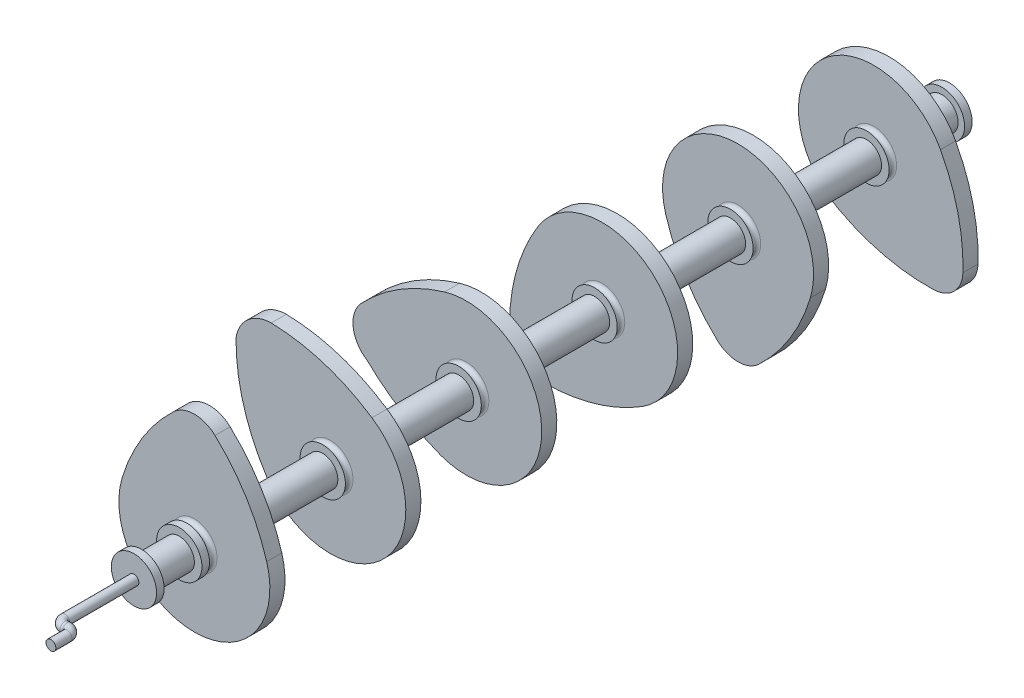
from build123d import *

# Parameters (mm, degrees)
SKETCH1_R            = 76.2
BOSS_EXTRUDE4_DEPTH  = 25.4
SKETCH7_R            = 50.8
BOSS_EXTRUDE5_DEPTH  = 127
SKETCH8_R            = 76.2
BOSS_EXTRUDE6_DEPTH  = 25.4
BOSS_EXTRUDE7_DEPTH  = 50.8
BOSS_EXTRUDE8_START  = 381
SKETCH12_R           = 50.8
BOSS_EXTRUDE8_DEPTH  = 381
BOSS_EXTRUDE10_DEPTH = 50.8
BOSS_EXTRUDE11_START = 381
SKETCH15_R           = 50.8
BOSS_EXTRUDE11_DEPTH = 381
BOSS_EXTRUDE12_DEPTH = 50.8
BOSS_EXTRUDE13_START = 381
SKETCH19_R           = 50.8
BOSS_EXTRUDE13_DEPTH = 381
BOSS_EXTRUDE14_DEPTH = 50.8
BOSS_EXTRUDE15_START = 381
SKETCH23_R           = 50.8
BOSS_EXTRUDE15_DEPTH = 381
BOSS_EXTRUDE16_DEPTH = 50.8
BOSS_EXTRUDE17_START = 381
SKETCH26_R           = 50.8
BOSS_EXTRUDE17_DEPTH = 381
BOSS_EXTRUDE18_DEPTH = 50.8
SKETCH29_R           = 54.344540656
BOSS_EXTRUDE19_DEPTH = 177.8
BOSS_EXTRUDE20_START = 25.4
SKETCH30_R           = 76.2
BOSS_EXTRUDE20_DEPTH = 25.4
SKETCH33_R           = 16.51


with BuildPart() as part:
    # Sketch1 → Boss-Extrude4 (new body)
    with BuildSketch(Plane.XY):
        Circle(SKETCH1_R)
    extrude(amount=BOSS_EXTRUDE4_DEPTH)

    # Sketch7 → Boss-Extrude5 (add)
    with BuildSketch(Plane.XY.offset(25.4)):
        Circle(SKETCH7_R)
    extrude(amount=BOSS_EXTRUDE5_DEPTH)

    # Sketch8 → Boss-Extrude6 (add)
    with BuildSketch(Plane.XY.offset(152.4)):
        Circle(SKETCH8_R)
    extrude(amount=BOSS_EXTRUDE6_DEPTH)

    # Sketch10 → Revolve2 (revolve)
    with BuildSketch(Plane(origin=(0, 0, 0), x_dir=(0, 0, -1), z_dir=(1, 0, 0))):
        with BuildLine():
            Line((0, 0), (25.4, 0))
            Line((25.4, 0), (25.4, 76.2))
            ThreePointArc((25.4, 76.2), (12.7, 63.5), (0, 76.2))
            Line((0, 76.2), (0, 0))
        make_face()
    revolve(axis=Axis((0, 0, 0), (0, 0, -1)))

    # Sketch11 → Boss-Extrude7 (add)
    with BuildSketch(Plane(origin=(0, 0, -25.4), x_dir=(-1, 0, 0), z_dir=(0, 0, -1))):
        with BuildLine():
            ThreePointArc((-243.247380948, 73.121212121), (0, -254), (243.247380948, 73.121212121))
            ThreePointArc((243.247380948, 73.121212121), (174.897670874, 224.794944599), (69.499251699, 353.510822511))
            ThreePointArc((69.499251699, 353.510822511), (0, 381), (-69.499251699, 353.510822511))
            ThreePointArc((-69.499251699, 353.510822511), (-174.897670874, 224.794944599), (-243.247380948, 73.121212121))
        make_face()
    extrude(amount=BOSS_EXTRUDE7_DEPTH)

    # Sketch12 → Boss-Extrude8 (add)
    with BuildSketch(Plane(origin=(0, 0, -76.2), x_dir=(-1, 0, 0), z_dir=(0, 0, -1)).offset(BOSS_EXTRUDE8_START)):
        Circle(SKETCH12_R)
    extrude(amount=-BOSS_EXTRUDE8_DEPTH)

    # Sketch13 → Revolve3 (revolve)
    with BuildSketch(Plane(origin=(0, 0, 0), x_dir=(0, 0, -1), z_dir=(1, 0, 0))):
        with BuildLine():
            Line((457.2, 0), (482.6, 0))
            Line((482.6, 0), (482.6, 76.2))
            ThreePointArc((482.6, 76.2), (469.9, 63.5), (457.2, 76.2))
            Line((457.2, 76.2), (457.2, 0))
        make_face()
    revolve(axis=Axis((0, 0, -457.2), (0, 0, -1)))

    # Sketch14 → Boss-Extrude10 (add)
    with BuildSketch(Plane(origin=(0, 0, -482.6), x_dir=(-1, 0, 0), z_dir=(0, 0, -1))):
        with BuildLine():
            ThreePointArc((-140.055337565, 211.897386533), (-179.605122421, -179.605122421), (211.897386533, -140.055337565))
            ThreePointArc((211.897386533, -140.055337565), (291.195568065, 30.379719884), (317.120856754, 216.562935583))
            ThreePointArc((317.120856754, 216.562935583), (276.630280142, 289.234224741), (198.800955585, 318.614478333))
            ThreePointArc((198.800955585, 318.614478333), (21.75767384, 289.436093569), (-140.055337565, 211.897386533))
        make_face()
    extrude(amount=BOSS_EXTRUDE10_DEPTH)

    # Sketch15 → Boss-Extrude11 (add)
    with BuildSketch(Plane(origin=(0, 0, -533.4), x_dir=(-1, 0, 0), z_dir=(0, 0, -1)).offset(BOSS_EXTRUDE11_START)):
        Circle(SKETCH15_R)
    extrude(amount=-BOSS_EXTRUDE11_DEPTH)

    # Sketch17 → Revolve4 (revolve)
    with BuildSketch(Plane(origin=(0, 0, 0), x_dir=(0, 0, -1), z_dir=(1, 0, 0))):
        with BuildLine():
            Line((914.4, 0), (939.8, 0))
            Line((939.8, 0), (939.8, 76.2))
            ThreePointArc((939.8, 76.2), (927.1, 63.5), (914.4, 76.2))
            Line((914.4, 76.2), (914.4, 0))
        make_face()
    revolve(axis=Axis((0, 0, -914.4), (0, 0, -1)))

    # Sketch18 → Boss-Extrude12 (add)
    with BuildSketch(Plane(origin=(0, 0, -939.8), x_dir=(-1, 0, 0), z_dir=(0, 0, -1))):
        with BuildLine():
            ThreePointArc((333.417154616, -86.050607245), (380.162762393, -13.016363354), (353.510822511, 69.499251699))
            ThreePointArc((353.510822511, 69.499251699), (224.794944599, 174.897670874), (73.121212121, 243.247380948))
            ThreePointArc((73.121212121, 243.247380948), (-253.041089583, -22.050101644), (114.09295874, -226.933463301))
            ThreePointArc((114.09295874, -226.933463301), (231.062085307, -167.867501553), (333.417154616, -86.050607245))
        make_face()
    extrude(amount=BOSS_EXTRUDE12_DEPTH)

    # Sketch19 → Boss-Extrude13 (add)
    with BuildSketch(Plane(origin=(0, 0, -990.6), x_dir=(-1, 0, 0), z_dir=(0, 0, -1)).offset(BOSS_EXTRUDE13_START)):
        Circle(SKETCH19_R)
    extrude(amount=-BOSS_EXTRUDE13_DEPTH)

    # Sketch21 → Revolve5 (revolve)
    with BuildSketch(Plane(origin=(0, 0, 0), x_dir=(0, 0, -1), z_dir=(1, 0, 0))):
        with BuildLine():
            Line((1371.6, 0), (1397, 0))
            Line((1397, 0), (1397, 76.2))
            ThreePointArc((1397, 76.2), (1384.3, 63.5), (1371.6, 76.2))
            Line((1371.6, 76.2), (1371.6, 0))
        make_face()
    revolve(axis=Axis((0, 0, -1371.6), (0, 0, -1)))

    # Sketch22 → Boss-Extrude14 (add)
    with BuildSketch(Plane(origin=(0, 0, -1397), x_dir=(-1, 0, 0), z_dir=(0, 0, -1))):
        with BuildLine():
            ThreePointArc((196.775493442, -311.431192903), (278.082681543, -278.082681543), (311.431192903, -196.775493442))
            ThreePointArc((311.431192903, -196.775493442), (286.432865733, -24.711952191), (215.702346017, 134.12120609))
            ThreePointArc((215.702346017, 134.12120609), (-179.605122421, 179.605122421), (-134.12120609, -215.702346017))
            ThreePointArc((-134.12120609, -215.702346017), (24.711952191, -286.432865733), (196.775493442, -311.431192903))
        make_face()
    extrude(amount=BOSS_EXTRUDE14_DEPTH)

    # Sketch23 → Boss-Extrude15 (add)
    with BuildSketch(Plane(origin=(0, 0, -1447.8), x_dir=(-1, 0, 0), z_dir=(0, 0, -1)).offset(BOSS_EXTRUDE15_START)):
        Circle(SKETCH23_R)
    extrude(amount=-BOSS_EXTRUDE15_DEPTH)

    # Sketch24 → Revolve6 (revolve)
    with BuildSketch(Plane(origin=(0, 0, 0), x_dir=(0, 0, -1), z_dir=(1, 0, 0))):
        with BuildLine():
            Line((1828.8, 0), (1854.2, 0))
            Line((1854.2, 0), (1854.2, 76.2))
            ThreePointArc((1854.2, 76.2), (1841.5, 63.5), (1828.8, 76.2))
            Line((1828.8, 76.2), (1828.8, 0))
        make_face()
    revolve(axis=Axis((0, 0, -1828.8), (0, 0, -1)))

    # Sketch25 → Boss-Extrude16 (add)
    with BuildSketch(Plane(origin=(0, 0, -1854.2), x_dir=(-1, 0, 0), z_dir=(0, 0, -1))):
        with BuildLine():
            ThreePointArc((243.247380948, -73.121212121), (0, 254), (-243.247380948, -73.121212121))
            ThreePointArc((-243.247380948, -73.121212121), (-174.897670874, -224.794944599), (-69.499251699, -353.510822511))
            ThreePointArc((-69.499251699, -353.510822511), (0, -381), (69.499251699, -353.510822511))
            ThreePointArc((69.499251699, -353.510822511), (174.897670874, -224.794944599), (243.247380948, -73.121212121))
        make_face()
    extrude(amount=BOSS_EXTRUDE16_DEPTH)

    # Sketch26 → Boss-Extrude17 (add)
    with BuildSketch(Plane(origin=(0, 0, -1905), x_dir=(-1, 0, 0), z_dir=(0, 0, -1)).offset(BOSS_EXTRUDE17_START)):
        Circle(SKETCH26_R)
    extrude(amount=-BOSS_EXTRUDE17_DEPTH)

    # Sketch27 → Revolve7 (revolve)
    with BuildSketch(Plane(origin=(0, 0, 0), x_dir=(0, 0, -1), z_dir=(1, 0, 0))):
        with BuildLine():
            Line((2286, 0), (2311.4, 0))
            Line((2311.4, 0), (2311.4, 76.2))
            ThreePointArc((2311.4, 76.2), (2298.7, 63.5), (2286, 76.2))
            Line((2286, 76.2), (2286, 0))
        make_face()
    revolve(axis=Axis((0, 0, -2286), (0, 0, -1)))

    # Sketch28 → Boss-Extrude18 (add)
    with BuildSketch(Plane(origin=(0, 0, -2311.4), x_dir=(-1, 0, 0), z_dir=(0, 0, -1))):
        with BuildLine():
            ThreePointArc((120.297367635, -223.706377513), (179.605122421, 179.605122421), (-223.706377513, 120.297367635))
            ThreePointArc((-223.706377513, 120.297367635), (-282.625358791, -35.282700614), (-299.113291984, -200.826507656))
            ThreePointArc((-299.113291984, -200.826507656), (-269.407683632, -269.407683632), (-200.826507656, -299.113291984))
            ThreePointArc((-200.826507656, -299.113291984), (-35.282700614, -282.625358791), (120.297367635, -223.706377513))
        make_face()
    extrude(amount=BOSS_EXTRUDE18_DEPTH)

    # Sketch29 → Boss-Extrude19 (add)
    with BuildSketch(Plane(origin=(0, 0, -2362.2), x_dir=(-1, 0, 0), z_dir=(0, 0, -1))):
        Circle(SKETCH29_R)
    extrude(amount=BOSS_EXTRUDE19_DEPTH)

    # Sketch30 → Boss-Extrude20 (add)
    with BuildSketch(Plane(origin=(0, 0, -2540), x_dir=(-1, 0, 0), z_dir=(0, 0, -1)).offset(BOSS_EXTRUDE20_START)):
        Circle(SKETCH30_R)
    extrude(amount=-BOSS_EXTRUDE20_DEPTH)

    # Sweep1: sweep along a curve in space
    with BuildLine() as sweep1_path:
        Line((0, 0, 177.8), (0, 0, 410.21))
        ThreePointArc((21.59, 0, 431.8), (6.323564594, 0, 425.476435406), (0, 0, 410.21))
        Line((21.59, 0, 431.8), (29.21, 0, 431.8))
        ThreePointArc((29.21, 0, 431.8), (44.476435406, 0, 438.123564594), (50.8, 0, 453.39))
        Line((50.8, 0, 453.39), (50.8, 0, 508))
    # Sketch33 → Sweep1 (sweep)
    with BuildSketch(Plane.XY.offset(177.8)):
        Circle(SKETCH33_R)
    sweep(path=sweep1_path.line)


solid = part.part
